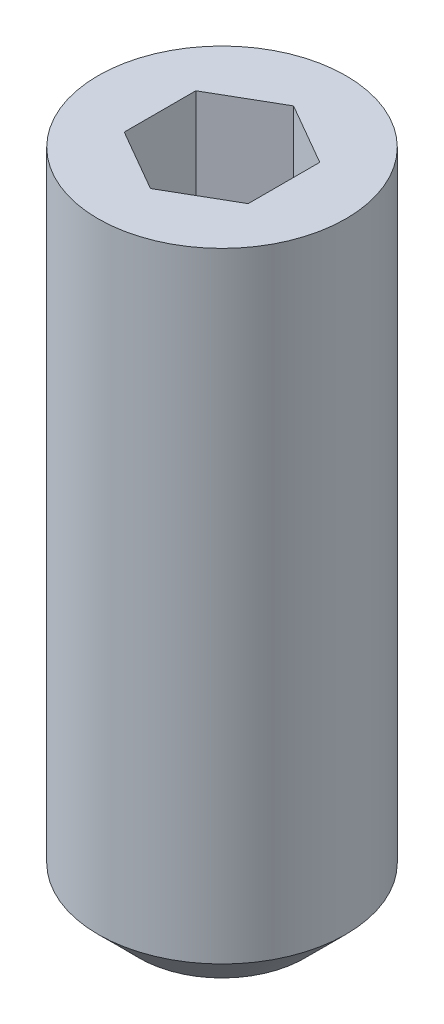
from build123d import *

# Parameters (mm, degrees)
SKETCH1_W          = 1.5
SKETCH1_H          = 8
CUT_EXTRUDE1_DEPTH = 2


with BuildPart() as part:
    # Sketch1 → Revolve1 (revolve)
    with BuildSketch(Plane.XY):
        with Locations((0.75, -4)):
            Rectangle(SKETCH1_W, SKETCH1_H)
    revolve(axis=Axis((0, 0, 0), (0, -1, 0)))

    # Sketch2 → Cut-Revolve1 (revolve, cut)
    with BuildSketch(Plane.XY):
        Polygon((0, 0), (0.75, 0), (0.75, -1.2), (0, -1.633012702), align=None)
    revolve(axis=Axis((0, 0, 0), (0, -1, 0)), mode=Mode.SUBTRACT)

    # Sketch3 → Cut-Extrude1 (cut)
    with BuildSketch(Plane(origin=(0, 0, 0), x_dir=(1, 0, 0), z_dir=(0, 1, 0))):
        Polygon((0, 0.866025404), (-0.75, 0.433012702), (-0.75, -0.433012702), (0, -0.866025404), (0.75, -0.433012702), (0.75, 0.433012702), align=None)
    extrude(amount=-CUT_EXTRUDE1_DEPTH, mode=Mode.SUBTRACT)

    # Sketch4 → Cut-Revolve2 (revolve, cut)
    with BuildSketch(Plane.XY):
        Polygon((1.5, -7.5), (1.5, -8), (1, -8), align=None)
    revolve(axis=Axis((0, 0, 0), (0, -1, 0)), mode=Mode.SUBTRACT)


solid = part.part
